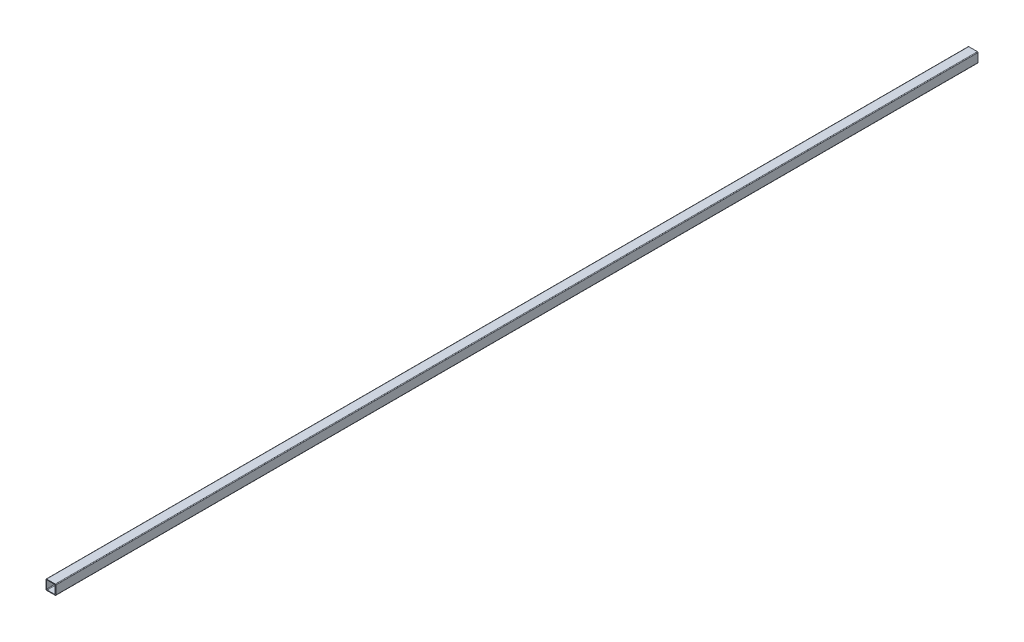
from build123d import *

# Parameters (mm, degrees)
SKETCH1_W           = 8
SKETCH1_H           = 8
SKETCH1_W_2         = 7
SKETCH1_H_2         = 7
BOSS_EXTRUDE1_DEPTH = 375
FILLET1_R           = 0.5


with BuildPart() as part:
    # Sketch1 → Boss-Extrude1 (new, symmetric)
    with BuildSketch(Plane.XY):
        Rectangle(SKETCH1_W, SKETCH1_H)
        Rectangle(SKETCH1_W_2, SKETCH1_H_2, mode=Mode.SUBTRACT)
    extrude(amount=BOSS_EXTRUDE1_DEPTH, both=True)

    # Fillet1
    fillet1_edges = [part.edges().sort_by_distance(p)[0] for p in [
        (4, 4, 0),
        (3.5, 3.5, 0),
        (4, -4, 0),
        (3.5, -3.5, 0),
        (-4, -4, 0),
        (-3.5, -3.5, 0),
        (-3.5, 3.5, 0),
        (-4, 4, 0),
    ]]
    fillet(fillet1_edges, radius=FILLET1_R)


solid = part.part
